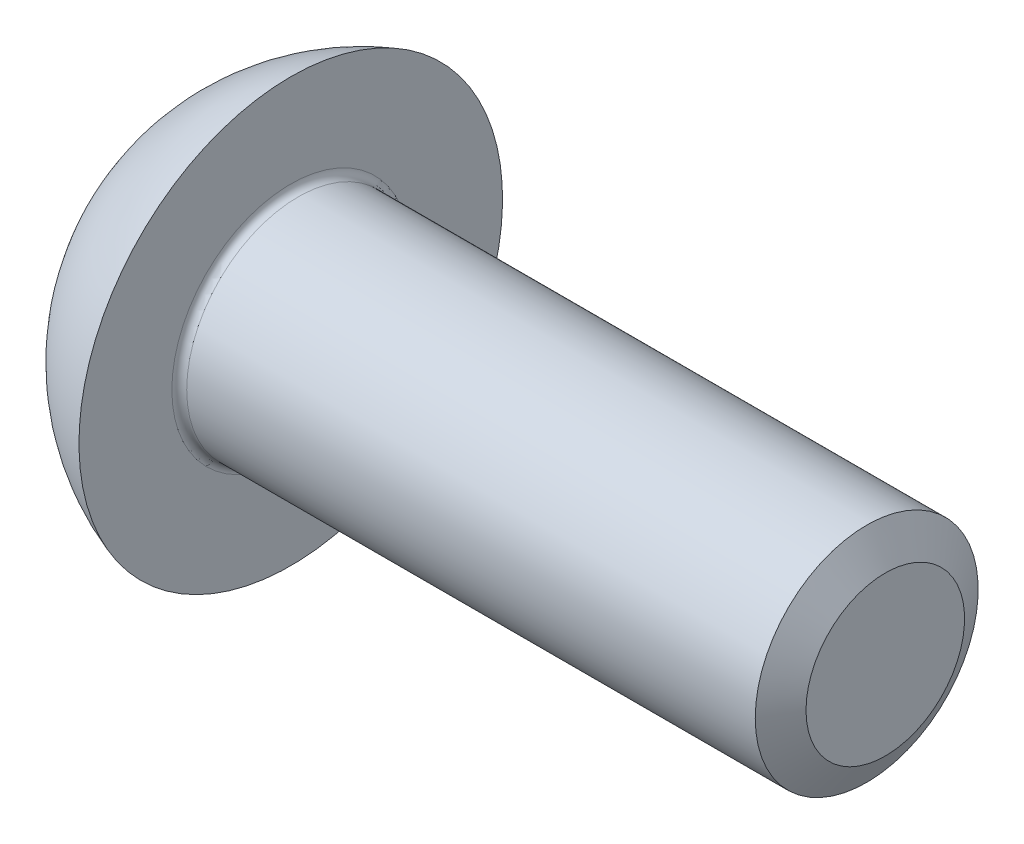
from build123d import *

# Parameters (mm, degrees)
CUT_EXTRUDE_1_DEPTH = 1.65


with BuildPart() as part:
    # 草图1 → 旋转1 (revolve)
    with BuildSketch(Plane.XY):
        with BuildLine():
            Line((0, 1.5), (-7.9, 1.5))
            ThreePointArc((-7.9, 1.5), (-7.970710678, 1.529289322), (-8, 1.6))
            Line((-8, 1.6), (-8, 2.85))
            ThreePointArc((-8, 2.85), (-8.948716751, 2.326209363), (-9.65, 1.5))
            Line((-9.65, 1.5), (-9.65, 0))
            Line((-9.65, 0), (0, 0))
            Line((0, 0), (0, 1.5))
        make_face()
    revolve(axis=Axis((-9.65, 0, 0), (1, 0, 0)))

    # 草图2 → 切除-拉伸1 (cut)
    with BuildSketch(Plane.ZY.offset(9.65)):
        Polygon((0, 1.154700538), (-1, 0.577350269), (-1, -0.577350269), (0, -1.154700538), (1, -0.577350269), (1, 0.577350269), align=None)
    extrude(amount=-CUT_EXTRUDE_1_DEPTH, mode=Mode.SUBTRACT)

    # 草图6 → 旋转2 (revolve)
    with BuildSketch(Plane.XY):
        Polygon((-8.61, 1.154700538), (-8, 0), (-7.7, 0), (-7.7, 1.154700538), align=None)
    revolve(axis=Axis((-9.65, 0, 0), (1, 0, 0)))

    # 草图7 → 切除-旋转5 (revolve, cut)
    with BuildSketch(Plane.XY):
        Polygon((-9.65, 1.154700538), (-9.35, 0), (-9.65, 0), align=None)
    revolve(axis=Axis((-9.65, 0, 0), (1, 0, 0)), mode=Mode.SUBTRACT)

    # 草图4 → 切除-旋转1 (revolve, cut)
    with BuildSketch(Plane.XY):
        Polygon((-0.25, 1.5), (0, 1.066987298), (0.25, 1.5), align=None)
    revolve(axis=Axis((-0.25, 0, 0), (1, 0, 0)), mode=Mode.SUBTRACT)


solid = part.part
